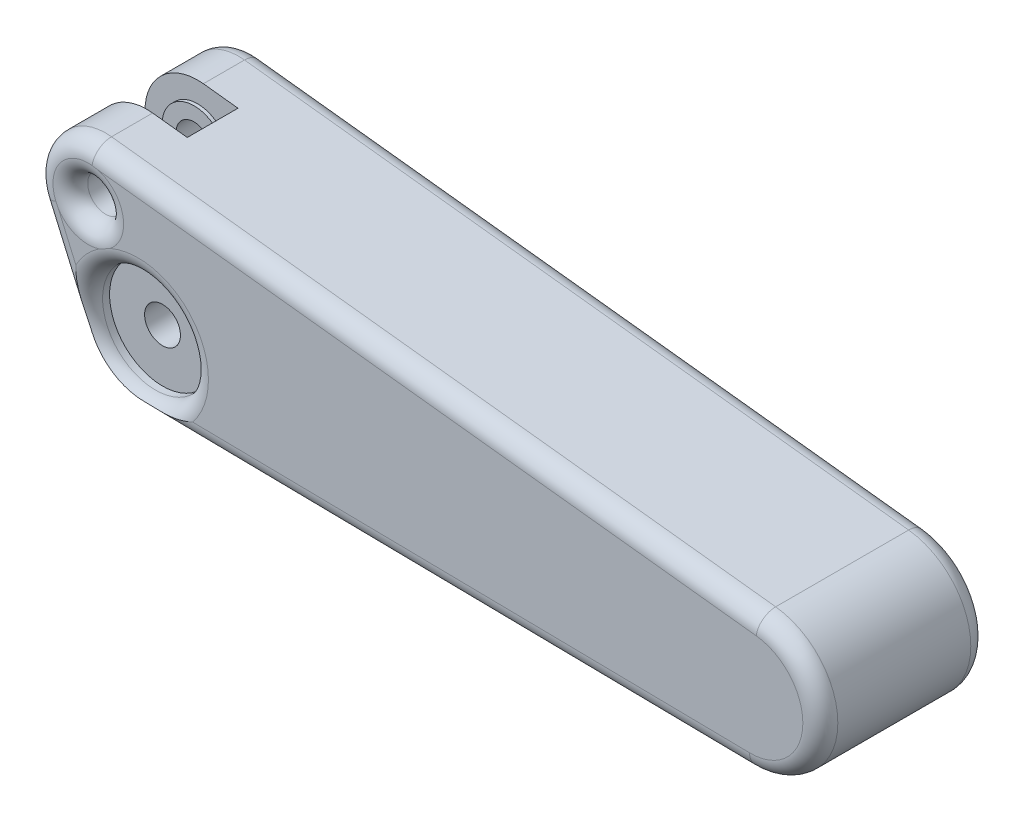
from build123d import *

# Parameters (mm, degrees)
EXTRUDE_1_DEPTH          = 4.8
EXTRUDE_1_DEPTH_BACK     = 4.8
CUT_EXTRUDE_1_DEPTH      = 1.45
CUT_EXTRUDE_1_DEPTH_BACK = 1.45
CUT_EXTRUDE_2_DEPTH      = 41.157146976
CUT_EXTRUDE_2_DEPTH_BACK = 41.157146976
SKETCH_4_R               = 1.025
SKETCH_5_R               = 1.825
SKETCH_5_R_2             = 1.025
EXTRUDE_2_DEPTH          = 0.2
SKETCH_6_R               = 3.025
CUT_EXTRUDE_3_DEPTH      = 1.4
FILLET_1_R               = 1


with BuildPart() as part:
    # 草图2 → 凸台-拉伸1 (new, two sides: drawn at the far end of the back side and taken through both)
    with BuildSketch(Plane.XY.offset(-EXTRUDE_1_DEPTH_BACK)):
        with BuildLine():
            Line((-5.59957118, 4.079804236), (-3.207763165, -1.40009124))
            ThreePointArc((-3.207763165, -1.40009124), (-1.937855629, -2.914569533), (-0.05, -3.499642839))
            Line((-0.05, -3.499642839), (34.942857143, -3.999591816))
            ThreePointArc((34.942857143, -3.999591816), (38.991974106, -0.25326417), (35.448775724, 3.974745319))
            Line((35.448775724, 3.974745319), (-2.513478103, 8.26094143))
            ThreePointArc((-2.513478103, 8.26094143), (-5.263777825, 7.06144517), (-5.59957118, 4.079804236))
        make_face()
    extrude(amount=EXTRUDE_1_DEPTH + EXTRUDE_1_DEPTH_BACK)

    # 草图3 → 切除-拉伸1 (cut, two sides: drawn at the far end of the back side and taken through both)
    with BuildSketch(Plane.XY.offset(-CUT_EXTRUDE_1_DEPTH_BACK)):
        with BuildLine():
            Line((0.710305238, 4.747153512), (-0.517930903, -3.461466103))
            ThreePointArc((-0.517930903, -3.461466103), (-2.128970562, -2.778036059), (-3.207763165, -1.40009124))
            Line((-3.207763165, -1.40009124), (-4.803529355, 2.255984778))
            ThreePointArc((-4.803529355, 2.255984778), (-4.332290932, 8.560582238), (0.710305238, 4.747153512))
        make_face()
    extrude(amount=CUT_EXTRUDE_1_DEPTH + CUT_EXTRUDE_1_DEPTH_BACK, mode=Mode.SUBTRACT)

    # 草图4 → 切除-拉伸2 (cut, two sides: drawn at the far end of the back side and taken through both)
    with BuildSketch(Plane.XY.offset(-CUT_EXTRUDE_2_DEPTH_BACK)):
        with Locations((-2.850059896, 5.279882441)):
            Circle(SKETCH_4_R)
        Circle(SKETCH_4_R)
    extrude(amount=CUT_EXTRUDE_2_DEPTH + CUT_EXTRUDE_2_DEPTH_BACK, mode=Mode.SUBTRACT)

    # 草图5 → 凸台-拉伸2 (add)
    with BuildSketch(Plane(origin=(0, 0, 1.45), x_dir=(-1, 0, 0), z_dir=(0, 0, -1))):
        with Locations(Location((2.850059896, 5.279882441, 0), (0, 0, 180))):
            Circle(SKETCH_5_R)
        with Locations(Location((2.850059896, 5.279882441, 0), (0, 0, 180))):
            Circle(SKETCH_5_R_2, mode=Mode.SUBTRACT)
    extrude_2 = extrude(amount=EXTRUDE_2_DEPTH)

    # 镜向1: 凸台-拉伸2 across plane
    add(extrude_2.mirror(Plane.XY))

    # 草图6 → 切除-拉伸3 (cut)
    with BuildSketch(Plane.XY.offset(4.8)):
        Circle(SKETCH_6_R)
    cut_extrude_3 = extrude(amount=-CUT_EXTRUDE_3_DEPTH, mode=Mode.SUBTRACT)

    # 镜向2: 切除-拉伸3 across plane
    add(cut_extrude_3.mirror(Plane.XY), mode=Mode.SUBTRACT)

    # 圆角1
    # the kernel refuses this fillet: 1 mm, written as the material it takes off along each edge
    with BuildSketch(Plane(origin=(-5.59957118, 4.079804236, 4.8), x_dir=(0, 0, -1), z_dir=(0.40002606845012584, -0.9165037613454379, 0))) as fillet_1_piece_1:
        with BuildLine():
            CenterArc((FILLET_1_R, FILLET_1_R), FILLET_1_R, 180, 90)
            Line((0, FILLET_1_R), (0, 0))
            Line((0, 0), (FILLET_1_R, 0))
        make_face()
    extrude(amount=5.979130372, mode=Mode.SUBTRACT)
    with BuildSketch(Plane(origin=(-2.850059896, 5.279882441, 4.8), x_dir=(0.11219393088675805, 0.9936863297198856, 0), z_dir=(0.9936863297198856, -0.11219393088675805, 0))) as fillet_1_piece_2:
        with BuildLine():
            CenterArc((3 - FILLET_1_R, -FILLET_1_R), FILLET_1_R, 0, 90)
            Line((3 - FILLET_1_R, 0), (3, 0))
            Line((3, 0), (3, -FILLET_1_R))
        make_face()
    revolve(axis=Axis((-2.850059896, 5.279882441, 4.8), (0, 0, 1)), revolution_arc=120.021609732, mode=Mode.SUBTRACT)
    with BuildSketch(Plane(origin=(0, 0, 4.8), x_dir=(-0.9165037613454377, -0.40002606845012634, 0), z_dir=(-0.40002606845012634, 0.9165037613454377, 0))) as fillet_1_piece_3:
        with BuildLine():
            CenterArc((3.5 - FILLET_1_R, -FILLET_1_R), FILLET_1_R, 0, 90)
            Line((3.5, -FILLET_1_R), (3.5, 0))
            Line((3.5, 0), (3.5 - FILLET_1_R, 0))
        make_face()
    revolve(axis=Axis((0, 0, 4.8), (0, 0, 1)), revolution_arc=65.601652868, mode=Mode.SUBTRACT)
    with BuildSketch(Plane(origin=(35.448775724, 3.974745319, 4.8), x_dir=(-0.1121939308867587, -0.9936863297198857, 0), z_dir=(-0.9936863297198857, 0.1121939308867587, 0))) as fillet_1_piece_4:
        with BuildLine():
            CenterArc((FILLET_1_R, -FILLET_1_R), FILLET_1_R, 90, 90)
            Line((0, -FILLET_1_R), (0, 0))
            Line((0, 0), (FILLET_1_R, 0))
        make_face()
    extrude(amount=38.203457863, mode=Mode.SUBTRACT)
    with BuildSketch(Plane(origin=(-0.05, -3.499642839, 4.8), x_dir=(0.014285714285714275, 0.9998979539769781, 0), z_dir=(0.9998979539769781, -0.014285714285714275, 0))) as fillet_1_piece_5:
        with BuildLine():
            CenterArc((FILLET_1_R, -FILLET_1_R), FILLET_1_R, 90, 90)
            Line((0, -FILLET_1_R), (0, 0))
            Line((0, 0), (FILLET_1_R, 0))
        make_face()
    extrude(amount=34.996428389, mode=Mode.SUBTRACT)
    with BuildSketch(Plane(origin=(35, 0, 4.8), x_dir=(-0.014285714285714242, -0.9998979539769781, 0), z_dir=(-0.9998979539769781, 0.014285714285714242, 0))) as fillet_1_piece_6:
        with BuildLine():
            CenterArc((4 - FILLET_1_R, -FILLET_1_R), FILLET_1_R, 0, 90)
            Line((4, -FILLET_1_R), (4, 0))
            Line((4, 0), (4 - FILLET_1_R, 0))
        make_face()
    revolve(axis=Axis((35, 0, 4.8), (0, 0, 1)), revolution_arc=174.3767374, mode=Mode.SUBTRACT)
    # the kernel refuses this fillet: 1 mm, written as the material it takes off along each edge
    with BuildSketch(Plane(origin=(0, 0, 4.8), x_dir=(-0.9475894723190804, 0.31949051934298006, 0), z_dir=(0.31949051934298006, 0.9475894723190804, 0))) as fillet_1_2_piece_1:
        with BuildLine():
            CenterArc((3.025 + FILLET_1_R, -FILLET_1_R), FILLET_1_R, 90, 90)
            Line((3.025, -FILLET_1_R), (3.025, 0))
            Line((3.025, 0), (3.025 + FILLET_1_R, 0))
        make_face()
    revolve(axis=Axis((0, 0, 4.8), (0, 0, 1)), revolution_arc=198.63211646, mode=Mode.SUBTRACT)
    with BuildSketch(Plane(origin=(0, 0, 4.8), x_dir=(1, 0, 0), z_dir=(0, -1, 0))) as fillet_1_2_piece_2:
        with BuildLine():
            CenterArc((3.025 + FILLET_1_R, -FILLET_1_R), FILLET_1_R, 90, 90)
            Line((3.025, -FILLET_1_R), (3.025, 0))
            Line((3.025, 0), (3.025 + FILLET_1_R, 0))
        make_face()
    revolve(axis=Axis((0, 0, 4.8), (0, 0, 1)), revolution_arc=311.572966215, mode=Mode.SUBTRACT)
    # the kernel refuses this fillet: 1 mm, written as the material it takes off along each edge
    with BuildSketch(Plane(origin=(-2.850059896, 5.279882441, 4.8), x_dir=(1, 0, 0), z_dir=(0, 1, 0))) as fillet_1_3_piece_1:
        with BuildLine():
            CenterArc((1.025 + FILLET_1_R, FILLET_1_R), FILLET_1_R, 180, 90)
            Line((1.025, FILLET_1_R), (1.025, 0))
            Line((1.025, 0), (1.025 + FILLET_1_R, 0))
        make_face()
    revolve(axis=Axis((-2.850059896, 5.279882441, 4.8), (0, 0, -1)), mode=Mode.SUBTRACT)
    # the kernel refuses this fillet: 1 mm, written as the material it takes off along each edge
    with BuildSketch(Plane(origin=(0, 0, -4.8), x_dir=(-0.9165037613454377, -0.40002606845012634, 0), z_dir=(-0.40002606845012634, 0.9165037613454377, 0))) as fillet_1_4_piece_1:
        with BuildLine():
            CenterArc((3.5 - FILLET_1_R, FILLET_1_R), FILLET_1_R, 270, 90)
            Line((3.5 - FILLET_1_R, 0), (3.5, 0))
            Line((3.5, 0), (3.5, FILLET_1_R))
        make_face()
    revolve(axis=Axis((0, 0, -4.8), (0, 0, 1)), revolution_arc=65.601652868, mode=Mode.SUBTRACT)
    with BuildSketch(Plane(origin=(35.448775724, 3.974745319, -4.8), x_dir=(0, 0, 1), z_dir=(-0.9936863297198857, 0.1121939308867587, 0))) as fillet_1_4_piece_2:
        with BuildLine():
            CenterArc((FILLET_1_R, -FILLET_1_R), FILLET_1_R, 90, 90)
            Line((0, -FILLET_1_R), (0, 0))
            Line((0, 0), (FILLET_1_R, 0))
        make_face()
    extrude(amount=38.203457863, mode=Mode.SUBTRACT)
    with BuildSketch(Plane(origin=(-0.05, -3.499642839, -4.8), x_dir=(0.014285714285714275, 0.9998979539769781, 0), z_dir=(0.9998979539769781, -0.014285714285714275, 0))) as fillet_1_4_piece_3:
        with BuildLine():
            CenterArc((FILLET_1_R, FILLET_1_R), FILLET_1_R, 180, 90)
            Line((0, FILLET_1_R), (0, 0))
            Line((0, 0), (FILLET_1_R, 0))
        make_face()
    extrude(amount=34.996428389, mode=Mode.SUBTRACT)
    with BuildSketch(Plane(origin=(35, 0, -4.8), x_dir=(-0.014285714285714242, -0.9998979539769781, 0), z_dir=(-0.9998979539769781, 0.014285714285714242, 0))) as fillet_1_4_piece_4:
        with BuildLine():
            CenterArc((4 - FILLET_1_R, FILLET_1_R), FILLET_1_R, 270, 90)
            Line((4, FILLET_1_R), (4, 0))
            Line((4, 0), (4 - FILLET_1_R, 0))
        make_face()
    revolve(axis=Axis((35, 0, -4.8), (0, 0, 1)), revolution_arc=174.3767374, mode=Mode.SUBTRACT)
    with BuildSketch(Plane(origin=(-5.59957118, 4.079804236, -4.8), x_dir=(0, 0, 1), z_dir=(0.40002606845012584, -0.9165037613454379, 0))) as fillet_1_4_piece_5:
        with BuildLine():
            CenterArc((FILLET_1_R, -FILLET_1_R), FILLET_1_R, 90, 90)
            Line((0, -FILLET_1_R), (0, 0))
            Line((0, 0), (FILLET_1_R, 0))
        make_face()
    extrude(amount=5.979130372, mode=Mode.SUBTRACT)
    with BuildSketch(Plane(origin=(-2.850059896, 5.279882441, -4.8), x_dir=(0.11219393088675805, 0.9936863297198856, 0), z_dir=(0.9936863297198856, -0.11219393088675805, 0))) as fillet_1_4_piece_6:
        with BuildLine():
            CenterArc((3 - FILLET_1_R, FILLET_1_R), FILLET_1_R, 270, 90)
            Line((3, FILLET_1_R), (3, 0))
            Line((3, 0), (3 - FILLET_1_R, 0))
        make_face()
    revolve(axis=Axis((-2.850059896, 5.279882441, -4.8), (0, 0, 1)), revolution_arc=120.021609732, mode=Mode.SUBTRACT)
    # the kernel refuses this fillet: 1 mm, written as the material it takes off along each edge
    with BuildSketch(Plane(origin=(0, 0, -4.8), x_dir=(1, 0, 0), z_dir=(0, -1, 0))) as fillet_1_5_piece_1:
        with BuildLine():
            CenterArc((3.025 + FILLET_1_R, FILLET_1_R), FILLET_1_R, 180, 90)
            Line((3.025 + FILLET_1_R, 0), (3.025, 0))
            Line((3.025, 0), (3.025, FILLET_1_R))
        make_face()
    revolve(axis=Axis((0, 0, -4.8), (0, 0, 1)), revolution_arc=311.572966215, mode=Mode.SUBTRACT)
    with BuildSketch(Plane(origin=(0, 0, -4.8), x_dir=(-0.9475894723190804, 0.31949051934298006, 0), z_dir=(0.31949051934298006, 0.9475894723190804, 0))) as fillet_1_5_piece_2:
        with BuildLine():
            CenterArc((3.025 + FILLET_1_R, FILLET_1_R), FILLET_1_R, 180, 90)
            Line((3.025 + FILLET_1_R, 0), (3.025, 0))
            Line((3.025, 0), (3.025, FILLET_1_R))
        make_face()
    revolve(axis=Axis((0, 0, -4.8), (0, 0, 1)), revolution_arc=198.63211646, mode=Mode.SUBTRACT)
    # the kernel refuses this fillet: 1 mm, written as the material it takes off along each edge
    with BuildSketch(Plane(origin=(-2.850059896, 5.279882441, -4.8), x_dir=(1, 0, 0), z_dir=(0, -1, 0))) as fillet_1_6_piece_1:
        with BuildLine():
            CenterArc((1.025 + FILLET_1_R, FILLET_1_R), FILLET_1_R, 180, 90)
            Line((1.025, FILLET_1_R), (1.025, 0))
            Line((1.025, 0), (1.025 + FILLET_1_R, 0))
        make_face()
    revolve(axis=Axis((-2.850059896, 5.279882441, -4.8), (0, 0, 1)), mode=Mode.SUBTRACT)


solid = part.part
